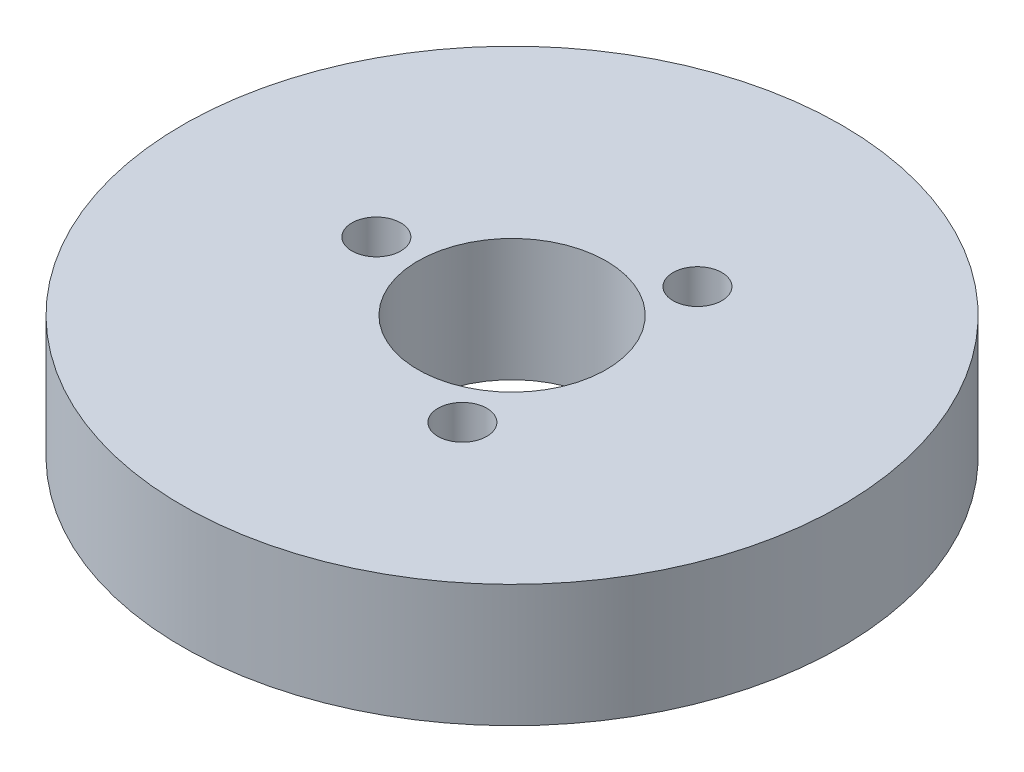
from build123d import *

# Parameters (mm, degrees)
SKETCH1_R           = 70
BOSS_EXTRUDE1_DEPTH = 26
SKETCH2_R           = 20
CUT_EXTRUDE1_DEPTH  = 103.352332655
SKETCH3_R           = 5.186570481
CUT_EXTRUDE2_DEPTH  = 21.399046879
CIRPATTERN1_COUNT   = 3


with BuildPart() as part:
    # Sketch1 → Boss-Extrude1 (new body)
    with BuildSketch(Plane(origin=(0, 0, 0), x_dir=(1, 0, 0), z_dir=(0, 1, 0))):
        Circle(SKETCH1_R)
    extrude(amount=BOSS_EXTRUDE1_DEPTH)

    # Sketch2 → Cut-Extrude1 (cut, through all)
    with BuildSketch(Plane(origin=(0, 0, 0), x_dir=(1, 0, 0), z_dir=(0, 1, 0))):
        Circle(SKETCH2_R)
    extrude(amount=CUT_EXTRUDE1_DEPTH, mode=Mode.SUBTRACT)

    # Sketch3 → Cut-Extrude2 (cut)
    with BuildSketch(Plane(origin=(0, 26, 0), x_dir=(1, 0, 0), z_dir=(0, 1, 0))):
        with Locations((-28.824602542, 0)):
            Circle(SKETCH3_R)
    cut_extrude2 = extrude(amount=-CUT_EXTRUDE2_DEPTH, mode=Mode.SUBTRACT)

    # CirPattern1: Cut-Extrude2 ×3 about axis
    cirpattern1_axis = Axis((0, 0, 0), (0, 1, 0))
    for i in range(1, CIRPATTERN1_COUNT):
        add(cut_extrude2.rotate(cirpattern1_axis, i * 360 / CIRPATTERN1_COUNT), mode=Mode.SUBTRACT)


solid = part.part
